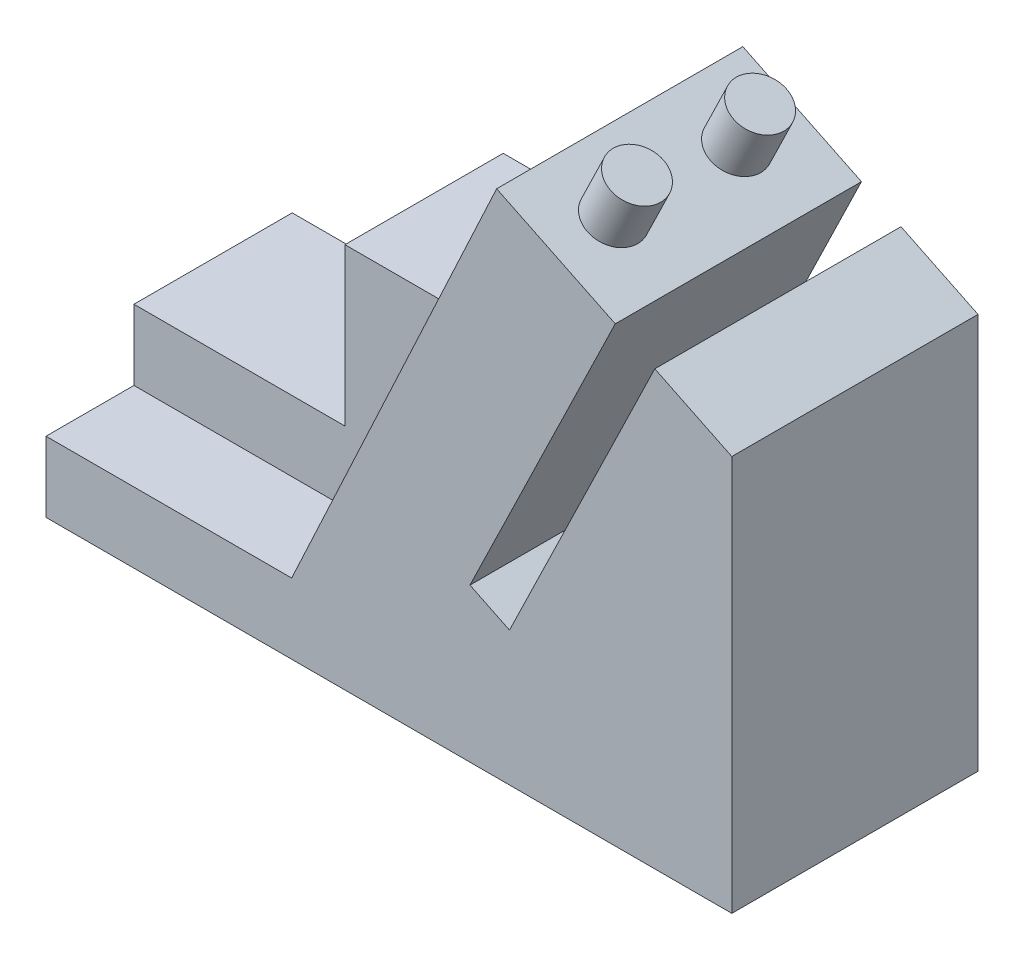
from build123d import *

# Parameters (mm, degrees)
BOSS_EXTRUDE7_DEPTH = 28
BOSS_EXTRUDE8_DEPTH = 18
SKETCH9_R           = 3
BOSS_EXTRUDE9_DEPTH = 6


with BuildPart() as part:
    # Sketch7 → Boss-Extrude7 (new body)
    with BuildSketch(Plane.XY):
        Polygon((499.594089275, 669.119369649), (577.594089275, 669.119369649), (577.594089275, 714.119369649), (568.83606364, 718.376281902), (552.310076773, 684.376281902), (547.813144369, 686.562053839), (564.339131237, 720.562053839), (550.848334027, 727.119369649), (539.594089275, 702.984563894), (527.532951119, 677.119369649), (499.594089275, 677.119369649), align=None)
    extrude(amount=BOSS_EXTRUDE7_DEPTH)

    # Sketch7<7> → Boss-Extrude8 (add)
    with BuildSketch(Plane.XY):
        Polygon((499.594089275, 685.119369649), (499.594089275, 677.119369649), (527.532951119, 677.119369649), (539.594089275, 702.984563894), (523.594089275, 702.984563894), (523.594089275, 685.119369649), align=None)
    extrude(amount=BOSS_EXTRUDE8_DEPTH)

    # Sketch9 → Boss-Extrude9 (add)
    with BuildSketch(Plane(origin=(391.151362028, 804.741430297, 0), x_dir=(0.8993864806899988, -0.43715438731878065, 0), z_dir=(0.43715438731878065, 0.8993864806899988, 0))):
        with Locations((184.611103409, -21)):
            Circle(SKETCH9_R)
        with Locations((184.611103409, -7)):
            Circle(SKETCH9_R)
    extrude(amount=BOSS_EXTRUDE9_DEPTH)


solid = part.part
